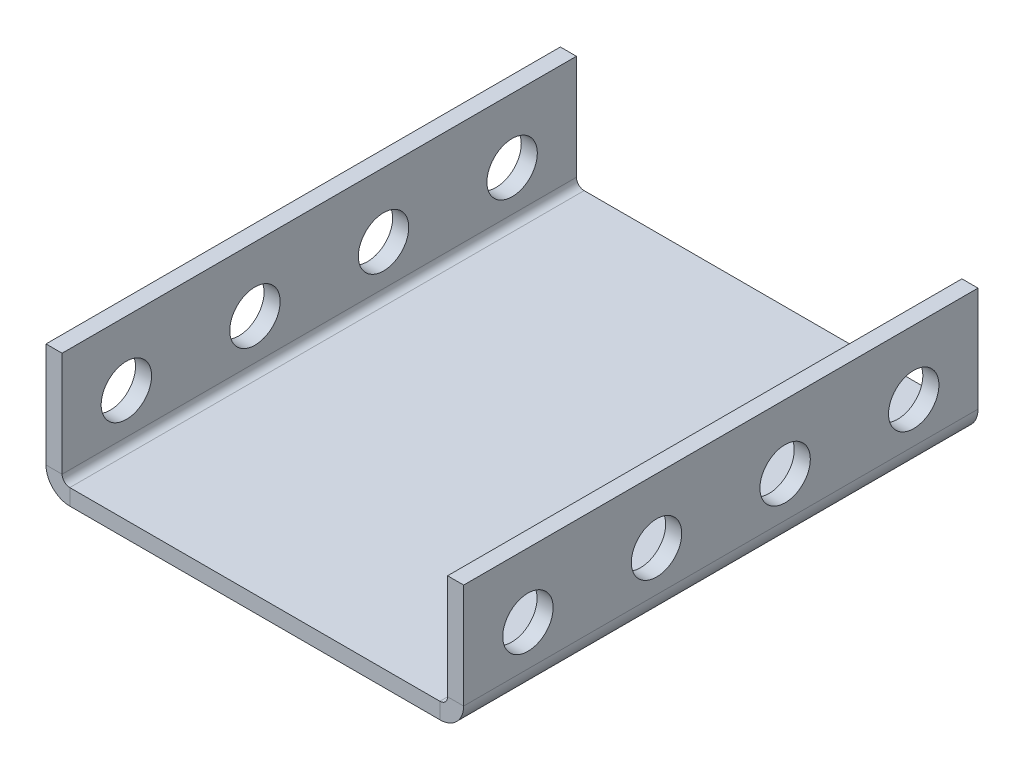
from build123d import *

# Parameters (mm, degrees)
BASE_FLANGE1_DEPTH      = 50.8
CUT_EXTRUDE1_DEPTH      = 57.278880364
CUT_EXTRUDE1_DEPTH_BACK = 57.278880364
SKETCH6_R               = 2.4892


# Sheet-metal steps are written as plain solids
with BuildPart() as part:
    # Sketch1 → Base-Flange1 (new body)
    with BuildSketch(Plane.XY):
        with BuildLine():
            Line((-20.6248, 12.7), (-20.6248, 2.3495))
            ThreePointArc((-20.6248, 2.3495), (-19.936647382, 0.688152618), (-18.2753, 0))
            Line((-18.2753, 0), (18.2753, 0))
            ThreePointArc((18.2753, 0), (19.936647382, 0.688152618), (20.6248, 2.3495))
            Line((20.6248, 2.3495), (20.6248, 12.7))
            Line((20.6248, 12.7), (19.0373, 12.7))
            Line((19.0373, 12.7), (19.0373, 2.3495))
            ThreePointArc((19.0373, 2.3495), (18.814115367, 1.810684633), (18.2753, 1.5875))
            Line((18.2753, 1.5875), (-18.2753, 1.5875))
            ThreePointArc((-18.2753, 1.5875), (-18.814115367, 1.810684633), (-19.0373, 2.3495))
            Line((-19.0373, 2.3495), (-19.0373, 12.7))
            Line((-19.0373, 12.7), (-20.6248, 12.7))
        make_face()
    extrude(amount=BASE_FLANGE1_DEPTH)

    # Sketch6 → Cut-Extrude1 (cut, two sides: drawn at the far end of the back side and taken through both)
    with BuildSketch(Plane(origin=(0, 0, 0), x_dir=(0, 0, -1), z_dir=(1, 0, 0)).offset(-CUT_EXTRUDE1_DEPTH_BACK)):
        with Locations((-44.45, 6.35)):
            Circle(SKETCH6_R)
        with Locations((-31.75, 6.35)):
            Circle(SKETCH6_R)
        with Locations((-19.05, 6.35)):
            Circle(SKETCH6_R)
        with Locations((-6.35, 6.35)):
            Circle(SKETCH6_R)
        with Locations((6.35, 6.35)):
            Circle(SKETCH6_R)
    extrude(amount=CUT_EXTRUDE1_DEPTH + CUT_EXTRUDE1_DEPTH_BACK, mode=Mode.SUBTRACT)


solid = part.part
